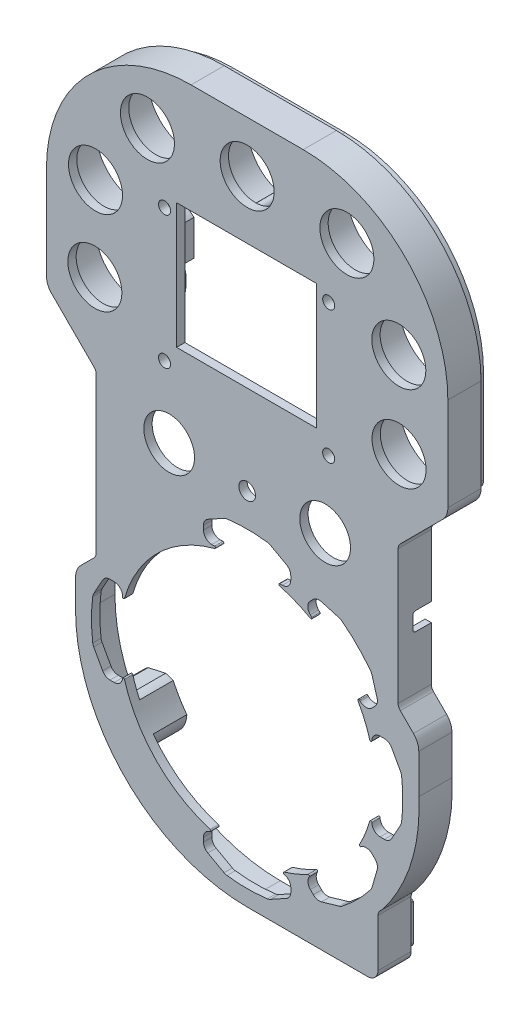
from build123d import *

# Parameters (mm, degrees)
SKETCH1_R               = 6.1
SKETCH1_R_2             = 6.5
BOSS_EXTRUDE1_DEPTH     = 2
CUT_EXTRUDE1_DEPTH      = 133.441116858
CUT_EXTRUDE3_DEPTH      = 133.441116858
BOSS_EXTRUDE4_START     = 5.980000305
BOSS_EXTRUDE4_DEPTH     = 5.980000305
CUT_EXTRUDE4_DEPTH      = 133.560966625
CUT_EXTRUDE4_DEPTH_BACK = 133.560966625
BOSS_EXTRUDE5_START     = 8.080000305
BOSS_EXTRUDE5_DEPTH     = 8.080000305
CUT_EXTRUDE5_DEPTH      = 3
CUT_EXTRUDE6_DEPTH      = 10
BOSS_EXTRUDE6_START     = 8.080000305
SKETCH15_R              = 1.25
BOSS_EXTRUDE6_DEPTH     = 8.080000305
SKETCH19_R              = 1.25
CUT_EXTRUDE10_DEPTH     = 8.080000305
FILLET1_R               = 0.25
CUT_EXTRUDE8_REACH      = 134.809
CUT_EXTRUDE9_DEPTH      = 172.733907758
CUT_EXTRUDE9_DEPTH_BACK = 10


with BuildPart() as part:
    # Sketch1 → Boss-Extrude1 (new body)
    with BuildSketch(Plane.XY):
        with BuildLine():
            Line((-41.299003107, 6.798191237), (-41.300003121, -0.001030065))
            ThreePointArc((-41.300003121, -0.001030065), (-29.203231295, -29.204249424), (-3.121e-06, -41.300999967))
            Line((-3.121e-06, -41.300999967), (28.999485949, -41.300999967))
            ThreePointArc((28.999485949, -41.300999967), (30.767175628, -40.564301116), (31.499997627, -38.795000714))
            Line((31.499997627, -38.795000714), (31.499997627, -27.309500836))
            ThreePointArc((31.499997627, -27.309500836), (31.63430244, -26.63385822), (32.017236672, -26.061239585))
            Line((32.017236672, -26.061239585), (32.524378638, -25.55409762))
            ThreePointArc((32.524378638, -25.55409762), (39.458657299, -12.419720481), (41.298997857, 2.3182994))
            Line((41.298997857, 2.3182994), (41.298997857, 11.797499352))
            ThreePointArc((41.298997857, 11.797499352), (40.96697133, 13.468656782), (40.020236823, 14.885238069))
            Line((40.020236823, 14.885238069), (36.855286312, 18.05018738))
            ThreePointArc((36.855286312, 18.05018738), (36.472344775, 18.623755543), (36.336999236, 19.299999763))
            Line((36.336999236, 19.299999763), (36.336999236, 51.568244042))
            ThreePointArc((36.336999236, 51.568244042), (36.478862282, 52.248666191), (36.865040827, 52.826563722))
            Line((36.865040827, 52.826563722), (47.030710936, 62.992234075))
            ThreePointArc((47.030710936, 62.992234075), (47.97660492, 64.408868533), (48.308999519, 66.079521832))
            Line((48.308999519, 66.079521832), (48.299999624, 88.500010224))
            ThreePointArc((48.299999624, 88.500010224), (38.107234824, 113.10724243), (13.499999624, 123.3))
            Line((13.499999624, 123.3), (-13.500010601, 123.3))
            ThreePointArc((-13.500010601, 123.3), (-38.107242807, 113.107235201), (-48.300000376, 88.5))
            Line((-48.300000376, 88.5), (-48.300000376, 66.070499878))
            ThreePointArc((-48.300000376, 66.070499878), (-47.96797385, 64.399342448), (-47.021239342, 62.982761162))
            Line((-47.021239342, 62.982761162), (-36.855288831, 52.816811851))
            ThreePointArc((-36.855288831, 52.816811851), (-36.472347294, 52.243243687), (-36.337001756, 51.566999468))
            Line((-36.337001756, 51.566999468), (-36.337000925, 14.30146916))
            ThreePointArc((-36.337000925, 14.30146916), (-36.471783381, 13.625120162), (-36.854241827, 13.051238803))
            Line((-36.854241827, 13.051238803), (-40.019899155, 9.885581347))
            ThreePointArc((-40.019899155, 9.885581347), (-40.966751427, 8.469200628), (-41.299003107, 6.798191237))
        make_face()
        with Locations((-18.767998896, 45.999999683)):
            Circle(SKETCH1_R, mode=Mode.SUBTRACT)
        with Locations((18.767988791, 45.999994761)):
            Circle(SKETCH1_R, mode=Mode.SUBTRACT)
        with Locations((36.549952387, 71.35011767)):
            Circle(SKETCH1_R_2, mode=Mode.SUBTRACT)
        with Locations((36.499964594, 92.000126825)):
            Circle(SKETCH1_R_2, mode=Mode.SUBTRACT)
        with Locations((23.9998883, 109.00006579)):
            Circle(SKETCH1_R_2, mode=Mode.SUBTRACT)
        with Locations((0.000117182, 111.000035272)):
            Circle(SKETCH1_R_2, mode=Mode.SUBTRACT)
        with Locations((-24.000058294, 108.999882684)):
            Circle(SKETCH1_R_2, mode=Mode.SUBTRACT)
        with Locations((-36.499959112, 91.999882684)):
            Circle(SKETCH1_R_2, mode=Mode.SUBTRACT)
        with Locations((-36.649960638, 71.649876581)):
            Circle(SKETCH1_R_2, mode=Mode.SUBTRACT)
        with BuildLine():
            Line((8.498217528, -29.999989932), (7.320711296, -29.999989932))
            ThreePointArc((7.320711296, -29.999989932), (11.855484749, -28.504033505), (16.103422547, -26.322960291))
            Line((16.103422547, -26.322960291), (15.206897602, -27.219485237))
            ThreePointArc((15.206897602, -27.219485237), (14.621111164, -28.633698799), (15.206897602, -30.047912361))
            Line((15.206897602, -30.047912361), (15.928049055, -30.769063814))
            ThreePointArc((15.928049055, -30.769063814), (16.84292629, -31.291513163), (17.896363573, -31.276560982))
            Line((17.896363573, -31.276560982), (22.183094016, -30.040536539))
            ThreePointArc((22.183094016, -30.040536539), (22.53156957, -29.903582275), (22.848411695, -29.704076008))
            ThreePointArc((22.848411695, -29.704076008), (26.504829459, -26.492827623), (29.714297788, -22.834847291))
            ThreePointArc((29.714297788, -22.834847291), (29.91343032, -22.518342524), (30.050164983, -22.17030134))
            Line((30.050164983, -22.17030134), (31.284907406, -17.888017149))
            ThreePointArc((31.284907406, -17.888017149), (31.299859587, -16.834579866), (30.777410238, -15.919702631))
            Line((30.777410238, -15.919702631), (30.056258785, -15.198551178))
            ThreePointArc((30.056258785, -15.198551178), (28.642045223, -14.612764741), (27.22783166, -15.198551178))
            Line((27.22783166, -15.198551178), (26.136786034, -16.289596804))
            ThreePointArc((26.136786034, -16.289596804), (28.474385236, -11.660635441), (29.999524405, -6.704265414))
            Line((29.999524405, -6.704265414), (29.999524405, -8.679270824))
            ThreePointArc((29.999524405, -8.679270824), (30.585310842, -10.093484386), (31.999524405, -10.679270824))
            Line((31.999524405, -10.679270824), (33.01938657, -10.679270824))
            ThreePointArc((33.01938657, -10.679270824), (34.035729944, -10.401782404), (34.770049802, -9.646316969))
            Line((34.770049802, -9.646316969), (36.927224702, -5.741139538))
            ThreePointArc((36.927224702, -5.741139538), (37.076792841, -5.397888822), (37.159761821, -5.032775373))
            ThreePointArc((37.159761821, -5.032775373), (37.474544109, -0.176602068), (37.157398229, 4.67941745))
            ThreePointArc((37.157398229, 4.67941745), (37.074403526, 5.044028081), (36.924987253, 5.386816369))
            Line((36.924987253, 5.386816369), (34.770049802, 9.2879433))
            ThreePointArc((34.770049802, 9.2879433), (34.035729944, 10.043408735), (33.01938657, 10.320897154))
            Line((33.01938657, 10.320897154), (31.999524405, 10.320897154))
            ThreePointArc((31.999524405, 10.320897154), (30.585310842, 9.735110716), (29.999524405, 8.320897154))
            Line((29.999524405, 8.320897154), (29.999524405, 6.332821196))
            ThreePointArc((29.999524405, 6.332821196), (28.260277654, 11.806823537), (25.53182947, 16.861054577))
            Line((25.53182947, 16.861054577), (27.202639399, 15.190244647))
            ThreePointArc((27.202639399, 15.190244647), (28.616852962, 14.60445821), (30.031066524, 15.190244647))
            Line((30.031066524, 15.190244647), (30.752217977, 15.9113961))
            ThreePointArc((30.752217977, 15.9113961), (31.274667326, 16.826273335), (31.259715145, 17.879710618))
            Line((31.259715145, 17.879710618), (30.023690702, 22.166441061))
            ThreePointArc((30.023690702, 22.166441061), (29.886736438, 22.514916616), (29.687230171, 22.83175874))
            ThreePointArc((29.687230171, 22.83175874), (26.475981786, 26.488176505), (22.818001454, 29.697644834))
            ThreePointArc((22.818001454, 29.697644834), (22.501496686, 29.896777366), (22.153455503, 30.033512029))
            Line((22.153455503, 30.033512029), (17.871171312, 31.268254451))
            ThreePointArc((17.871171312, 31.268254451), (16.817734029, 31.283206632), (15.902856794, 30.760757283))
            Line((15.902856794, 30.760757283), (15.181705341, 30.03960583))
            ThreePointArc((15.181705341, 30.03960583), (14.595918903, 28.625392268), (15.181705341, 27.211178706))
            Line((15.181705341, 27.211178706), (17.046324537, 25.346559509))
            ThreePointArc((17.046324537, 25.346559509), (11.557478813, 28.255519634), (5.59540313, 29.999976553))
            Line((5.59540313, 29.999976553), (8.493548338, 29.999976553))
            ThreePointArc((8.493548338, 29.999976553), (9.907761901, 30.585762991), (10.493548338, 31.999976553))
            Line((10.493548338, 31.999976553), (10.493548338, 33.019838718))
            ThreePointArc((10.493548338, 33.019838718), (10.216059919, 34.036182092), (9.460594484, 34.77050195))
            Line((9.460594484, 34.77050195), (5.555417053, 36.92767685))
            ThreePointArc((5.555417053, 36.92767685), (5.212166337, 37.077244989), (4.847052888, 37.16021397))
            ThreePointArc((4.847052888, 37.16021397), (-0.009120418, 37.474996257), (-4.865139935, 37.157850378))
            ThreePointArc((-4.865139935, 37.157850378), (-5.229750566, 37.074855674), (-5.572538855, 36.925439401))
            Line((-5.572538855, 36.925439401), (-9.473665785, 34.77050195))
            ThreePointArc((-9.473665785, 34.77050195), (-10.22913122, 34.036182092), (-10.506619639, 33.019838718))
            Line((-10.506619639, 33.019838718), (-10.506619639, 31.999976553))
            ThreePointArc((-10.506619639, 31.999976553), (-9.920833202, 30.585762991), (-8.506619639, 29.999976553))
            Line((-8.506619639, 29.999976553), (-5.596307426, 29.999976553))
            ThreePointArc((-5.596307426, 29.999976553), (-21.37256636, 21.853396161), (-29.999984316, 6.33486603))
            Line((-29.999984316, 6.33486603), (-29.999984316, 8.499295286))
            ThreePointArc((-29.999984316, 8.499295286), (-30.585770754, 9.913508849), (-31.999984316, 10.499295286))
            Line((-31.999984316, 10.499295286), (-33.019846482, 10.499295286))
            ThreePointArc((-33.019846482, 10.499295286), (-34.036189856, 10.221806867), (-34.770509714, 9.466341432))
            Line((-34.770509714, 9.466341432), (-36.927684614, 5.561164001))
            ThreePointArc((-36.927684614, 5.561164001), (-37.077252753, 5.217913285), (-37.160221733, 4.852799836))
            ThreePointArc((-37.160221733, 4.852799836), (-37.47500402, -0.00337347), (-37.157858141, -4.859392987))
            ThreePointArc((-37.157858141, -4.859392987), (-37.074863438, -5.224003618), (-36.925447164, -5.566791907))
            Line((-36.925447164, -5.566791907), (-34.770509714, -9.467918837))
            ThreePointArc((-34.770509714, -9.467918837), (-34.036189856, -10.223384272), (-33.019846482, -10.500872691))
            Line((-33.019846482, -10.500872691), (-31.999984316, -10.500872691))
            ThreePointArc((-31.999984316, -10.500872691), (-30.585770754, -9.915086254), (-29.999984316, -8.500872691))
            Line((-29.999984316, -8.500872691), (-29.999984316, -6.706310248))
            ThreePointArc((-29.999984316, -6.706310248), (-21.997212331, -21.601429929), (-7.321615592, -29.999989932))
            Line((-7.321615592, -29.999989932), (-8.50195045, -29.999989932))
            ThreePointArc((-8.50195045, -29.999989932), (-9.916164012, -30.58577637), (-10.50195045, -31.999989932))
            Line((-10.50195045, -31.999989932), (-10.50195045, -33.019852097))
            ThreePointArc((-10.50195045, -33.019852097), (-10.224462031, -34.036195472), (-9.468996596, -34.770515329))
            Line((-9.468996596, -34.770515329), (-5.563819165, -36.92769023))
            ThreePointArc((-5.563819165, -36.92769023), (-5.220568448, -37.077258368), (-4.855454999, -37.160227349))
            ThreePointArc((-4.855454999, -37.160227349), (0.000718306, -37.475009636), (4.856737824, -37.157863757))
            ThreePointArc((4.856737824, -37.157863757), (5.221348455, -37.074869053), (5.564136743, -36.92545278))
            Line((5.564136743, -36.92545278), (9.465263674, -34.770515329))
            ThreePointArc((9.465263674, -34.770515329), (10.220729109, -34.036195472), (10.498217528, -33.019852097))
            Line((10.498217528, -33.019852097), (10.498217528, -31.999989932))
            ThreePointArc((10.498217528, -31.999989932), (9.91243109, -30.58577637), (8.498217528, -29.999989932))
        make_face(mode=Mode.SUBTRACT)
    extrude(amount=BOSS_EXTRUDE1_DEPTH)

    # Sketch4 → Cut-Extrude1 (cut, through all)
    with BuildSketch(Plane.XY.offset(2)):
        Polygon((-16.977005171, 66.853991338), (16.722994829, 66.85399723), (16.722989557, 97.00399723), (-16.977010443, 97.003991338), align=None)
    extrude(amount=-CUT_EXTRUDE1_DEPTH, mode=Mode.SUBTRACT)

    # Sketch8 → Cut-Extrude3 (cut, through all)
    with BuildSketch(Plane(origin=(0, 0, 2), x_dir=(-1, 0, 0), z_dir=(0, 0, -1))):
        with BuildLine():
            add(Edge.make_bspline(
                [(21.327009938, 94.528990578), (21.327010445, 97.428990578), (18.427010445, 97.428991085), (18.427009938, 94.528991085), (18.427009431, 91.628991085), (21.327009431, 91.628990578), (21.327009938, 94.528990578)],
                knots=[0, 0, 0, 0, 0.5, 0.5, 0.5, 1, 1, 1, 1], degree=3, weights=[1, 0.333333333, 0.333333333, 1, 0.333333333, 0.333333333, 1]))
        make_face()
        with BuildLine():
            add(Edge.make_bspline(
                [(21.327004352, 62.578990578), (21.327004859, 65.478990578), (18.427004859, 65.478991085), (18.427004352, 62.578991085), (18.427003845, 59.678991085), (21.327003845, 59.678990578), (21.327004352, 62.578990578)],
                knots=[0, 0, 0, 0, 0.5, 0.5, 0.5, 1, 1, 1, 1], degree=3, weights=[1, 0.333333333, 0.333333333, 1, 0.333333333, 0.333333333, 1]))
        make_face()
        with BuildLine():
            add(Edge.make_bspline(
                [(-18.172995648, 62.578997484), (-18.172995141, 65.478997484), (-21.072995141, 65.478997991), (-21.072995648, 62.578997991), (-21.072996155, 59.678997991), (-18.172996155, 59.678997484), (-18.172995648, 62.578997484)],
                knots=[0, 0, 0, 0, 0.5, 0.5, 0.5, 1, 1, 1, 1], degree=3, weights=[1, 0.333333333, 0.333333333, 1, 0.333333333, 0.333333333, 1]))
        make_face()
        with BuildLine():
            add(Edge.make_bspline(
                [(-18.172990062, 94.528997484), (-18.172989555, 97.428997484), (-21.072989555, 97.428997991), (-21.072990062, 94.528997991), (-21.072990569, 91.628997991), (-18.172990569, 91.628997484), (-18.172990062, 94.528997484)],
                knots=[0, 0, 0, 0, 0.5, 0.5, 0.5, 1, 1, 1, 1], degree=3, weights=[1, 0.333333333, 0.333333333, 1, 0.333333333, 0.333333333, 1]))
        make_face()
    extrude(amount=CUT_EXTRUDE3_DEPTH, mode=Mode.SUBTRACT)

    # Sketch9 → Boss-Extrude4 (add)
    with BuildSketch(Plane(origin=(0, 0, 0), x_dir=(-1, 0, 0), z_dir=(0, 0, -1)).offset(BOSS_EXTRUDE4_START)):
        with BuildLine():
            Line((41.300003121, -0.001030065), (41.299003107, 6.798191237))
            ThreePointArc((41.299003107, 6.798191237), (40.966751427, 8.469200628), (40.019899155, 9.885581347))
            Line((40.019899155, 9.885581347), (36.854241827, 13.051238803))
            ThreePointArc((36.854241827, 13.051238803), (36.471783381, 13.625120162), (36.337000925, 14.30146916))
            Line((36.337000925, 14.30146916), (36.337001756, 51.566999468))
            ThreePointArc((36.337001756, 51.566999468), (36.472347294, 52.243243687), (36.855288831, 52.816811851))
            Line((36.855288831, 52.816811851), (47.021239342, 62.982761162))
            ThreePointArc((47.021239342, 62.982761162), (47.96797385, 64.399342448), (48.300000376, 66.070499878))
            Line((48.300000376, 66.070499878), (48.300000376, 88.5))
            ThreePointArc((48.300000376, 88.5), (38.107242807, 113.107235201), (13.500010601, 123.3))
            Line((13.500010601, 123.3), (-13.499999624, 123.3))
            ThreePointArc((-13.499999624, 123.3), (-38.107234824, 113.10724243), (-48.299999624, 88.500010224))
            Line((-48.299999624, 88.500010224), (-48.308999519, 66.079521832))
            ThreePointArc((-48.308999519, 66.079521832), (-47.97660492, 64.408868533), (-47.030710936, 62.992234075))
            Line((-47.030710936, 62.992234075), (-36.865040827, 52.826563722))
            ThreePointArc((-36.865040827, 52.826563722), (-36.478862282, 52.248666191), (-36.336999236, 51.568244042))
            Line((-36.336999236, 51.568244042), (-36.336999236, 19.299999763))
            ThreePointArc((-36.336999236, 19.299999763), (-36.472344775, 18.623755543), (-36.855286312, 18.05018738))
            Line((-36.855286312, 18.05018738), (-40.020236823, 14.885238069))
            ThreePointArc((-40.020236823, 14.885238069), (-40.96697133, 13.468656782), (-41.298997857, 11.797499352))
            Line((-41.298997857, 11.797499352), (-41.298997857, 2.3182994))
            ThreePointArc((-41.298997857, 2.3182994), (-39.458657299, -12.419720481), (-32.524378638, -25.55409762))
            Line((-32.524378638, -25.55409762), (-32.017236672, -26.061239585))
            ThreePointArc((-32.017236672, -26.061239585), (-31.63430244, -26.63385822), (-31.499997627, -27.309500836))
            Line((-31.499997627, -27.309500836), (-31.499997627, -38.795000714))
            ThreePointArc((-31.499997627, -38.795000714), (-30.767175628, -40.564301116), (-28.999485949, -41.300999967))
            Line((-28.999485949, -41.300999967), (3.121e-06, -41.300999967))
            ThreePointArc((3.121e-06, -41.300999967), (29.203231295, -29.204249424), (41.300003121, -0.001030065))
        make_face()
        with BuildLine():
            Line((-34.836999236, 51.577035852), (-34.837000675, 19.298530673))
            ThreePointArc((-34.837000675, 19.298530673), (-35.08664303, 18.049447619), (-35.794020766, 16.990133274))
            Line((-35.794020766, 16.990133274), (-38.959715536, 13.824439048))
            ThreePointArc((-38.959715536, 13.824439048), (-39.581134457, 12.894674146), (-39.798997912, 11.797787744))
            Line((-39.798997912, 11.797787744), (-39.798997857, 2.275492803))
            ThreePointArc((-39.798997857, 2.275492803), (-38.047420179, -11.907055573), (-31.400013755, -24.557142159))
            Line((-31.400013755, -24.557142159), (-30.956920002, -25.000236134))
            ThreePointArc((-30.956920002, -25.000236134), (-30.248520921, -26.059741977), (-29.999997682, -27.309789227))
            Line((-29.999997682, -27.309789227), (-29.999998042, -38.794212098))
            ThreePointArc((-29.999998042, -38.794212098), (-29.705742188, -39.504415445), (-28.996508448, -39.800999967))
            Line((-28.996508448, -39.800999967), (-1.3697e-05, -39.800999968))
            ThreePointArc((-1.3697e-05, -39.800999968), (28.142532317, -28.143628059), (39.800003129, -0.001123009))
            Line((39.800003129, -0.001123009), (39.799003134, 6.798250529))
            ThreePointArc((39.799003134, 6.798250529), (39.580974331, 7.895073776), (38.959436668, 8.824723564))
            Line((38.959436668, 8.824723564), (35.792533025, 11.991629339))
            ThreePointArc((35.792533025, 11.991629339), (35.085842634, 13.05138922), (34.837001404, 14.300621278))
            Line((34.837001404, 14.300621278), (34.837003194, 51.568468574))
            ThreePointArc((34.837003194, 51.568468574), (35.086645534, 52.817551574), (35.794023216, 53.876865887))
            Line((35.794023216, 53.876865887), (45.960717986, 64.043560114))
            ThreePointArc((45.960717986, 64.043560114), (46.582136958, 64.97332504), (46.800000432, 66.070211487))
            Line((46.800000432, 66.070211487), (46.800000376, 88.499994322))
            ThreePointArc((46.800000376, 88.499994322), (37.046582557, 112.046575107), (13.500004702, 121.8))
            Line((13.500004702, 121.8), (-13.499993945, 121.8))
            ThreePointArc((-13.499993945, 121.8), (-37.046681171, 112.046475739), (-46.799999684, 88.499703265))
            Line((-46.799999684, 88.499703265), (-46.8089996, 66.079396043))
            ThreePointArc((-46.8089996, 66.079396043), (-46.590687906, 64.982657224), (-45.969777952, 64.052621294))
            Line((-45.969777952, 64.052621294), (-35.802337039, 53.885180277))
            ThreePointArc((-35.802337039, 53.885180277), (-35.094172189, 52.825417485), (-34.836999236, 51.577035852))
        make_face(mode=Mode.SUBTRACT)
    extrude(amount=-BOSS_EXTRUDE4_DEPTH)

    # Sketch10 → Cut-Extrude4 (cut, two sides: drawn at the far end of the back side and taken through both)
    with BuildSketch(Plane.ZY.offset(-CUT_EXTRUDE4_DEPTH_BACK)):
        with BuildLine():
            Line((-5.230000341, 36.549993102), (-2.230000341, 36.549993102))
            ThreePointArc((-2.230000341, 36.549993102), (-1.962121942, 36.496708778), (-1.735025597, 36.344967862))
            ThreePointArc((-1.735025597, 36.344967862), (-1.58328466, 36.117871523), (-1.530000319, 35.849993121))
            Line((-1.530000319, 35.849993121), (-1.530000319, 32.84999311))
            ThreePointArc((-1.530000319, 32.84999311), (-1.583284635, 32.582114708), (-1.73502555, 32.355018359))
            ThreePointArc((-1.73502555, 32.355018359), (-1.962121896, 32.203277423), (-2.230000305, 32.149993091))
            Line((-2.230000305, 32.149993091), (-5.230000305, 32.149993091))
            Line((-5.230000305, 32.149993091), (-5.980000305, 32.149993091))
            Line((-5.980000305, 32.149993091), (-5.980000305, 36.549993102))
            Line((-5.980000305, 36.549993102), (-5.230000341, 36.549993102))
        make_face()
    extrude(amount=CUT_EXTRUDE4_DEPTH + CUT_EXTRUDE4_DEPTH_BACK, mode=Mode.SUBTRACT)

    # Sketch11 → Boss-Extrude5 (add)
    # profile 1 of 2: a face of its own
    with BuildSketch(Plane(origin=(0, 0, 0), x_dir=(-1, 0, 0), z_dir=(0, 0, -1)).offset(BOSS_EXTRUDE5_START)):
        with BuildLine():
            ThreePointArc((-11.205806713, 106.994723534), (-7.384503856, 101.668324097), (-1.322339404, 99.173720191))
            Line((-1.322339404, 99.173720191), (1.322105041, 99.173720191))
            ThreePointArc((1.322105041, 99.173720191), (7.384269493, 101.668324097), (11.20557235, 106.994723534))
            Line((11.20557235, 106.994723534), (12.270210464, 106.994723534))
            ThreePointArc((12.270210464, 106.994723534), (17.045409632, 99.343648536), (25.815393125, 97.239161604))
            ThreePointArc((25.815393125, 97.239161604), (25.092007234, 88.613346487), (30.404739825, 81.779398434))
            ThreePointArc((30.404739825, 81.779398434), (25.694421402, 67.003786378), (39.590634433, 60.118942538))
            Line((39.590634433, 60.118942538), (42.778331278, 60.931884116))
            ThreePointArc((42.778331278, 60.931884116), (42.85498099, 60.960869655), (42.92329232, 61.006134455))
            Line((42.92329232, 61.006134455), (45.960717986, 64.043560114))
            ThreePointArc((45.960717986, 64.043560114), (46.582136959, 64.973325041), (46.800000413, 66.070211487))
            Line((46.800000413, 66.070211487), (46.800000376, 88.499994322))
            ThreePointArc((46.800000376, 88.499994322), (37.046582557, 112.046575107), (13.500004702, 121.8))
            Line((13.500004702, 121.8), (-13.499993945, 121.8))
            ThreePointArc((-13.499993945, 121.8), (-37.046681176, 112.046475735), (-46.799999654, 88.499703265))
            Line((-46.799999654, 88.499703265), (-46.8089996, 66.079396043))
            ThreePointArc((-46.8089996, 66.079396043), (-46.590687908, 64.982657227), (-45.969777975, 64.052621271))
            Line((-45.969777975, 64.052621271), (-44.184961095, 62.26780438))
            Line((-44.184961095, 62.26780438), (-44.122149582, 62.204992868))
            ThreePointArc((-44.122149582, 62.204992868), (-43.886865038, 61.989568793), (-43.637309154, 61.790852389))
            ThreePointArc((-43.637309154, 61.790852389), (-26.598105347, 64.824629446), (-30.60858936, 81.66073017))
            ThreePointArc((-30.60858936, 81.66073017), (-25.126151376, 88.500567519), (-25.81537685, 97.239301377))
            ThreePointArc((-25.81537685, 97.239301377), (-17.045347849, 99.343683082), (-12.270056125, 106.994723534))
            Line((-12.270056125, 106.994723534), (-11.205806713, 106.994723534))
        make_face()
        with BuildLine():
            Line((-37.649952387, 81.188816771), (-37.649952387, 79.55011767))
            ThreePointArc((-37.649952387, 79.55011767), (-36.549952387, 78.45011767), (-35.449952387, 79.55011767))
            Line((-35.449952387, 79.55011767), (-35.449952387, 81.188816771))
            ThreePointArc((-35.449952387, 81.188816771), (-36.549952387, 61.45011767), (-37.649952387, 81.188816771))
        make_face(mode=Mode.SUBTRACT)
        with BuildLine():
            Line((35.549960638, 81.488575682), (35.549960638, 79.849876581))
            ThreePointArc((35.549960638, 79.849876581), (36.649960638, 78.749876581), (37.749960638, 79.849876581))
            Line((37.749960638, 79.849876581), (37.749960638, 81.488575682))
            ThreePointArc((37.749960638, 81.488575682), (36.649960638, 61.749876581), (35.549960638, 81.488575682))
        make_face(mode=Mode.SUBTRACT)
        with BuildLine():
            Line((-37.599964594, 101.838825926), (-37.599964594, 100.200126825))
            ThreePointArc((-37.599964594, 100.200126825), (-36.499964594, 99.100126825), (-35.399964594, 100.200126825))
            Line((-35.399964594, 100.200126825), (-35.399964594, 101.838825926))
            ThreePointArc((-35.399964594, 101.838825926), (-36.499964594, 82.100126825), (-37.599964594, 101.838825926))
        make_face(mode=Mode.SUBTRACT)
        with BuildLine():
            Line((-25.0998883, 118.838764891), (-25.0998883, 117.20006579))
            ThreePointArc((-25.0998883, 117.20006579), (-23.9998883, 116.10006579), (-22.8998883, 117.20006579))
            Line((-22.8998883, 117.20006579), (-22.8998883, 118.838764891))
            ThreePointArc((-22.8998883, 118.838764891), (-23.9998883, 99.10006579), (-25.0998883, 118.838764891))
        make_face(mode=Mode.SUBTRACT)
        with BuildLine():
            Line((35.399959112, 101.838581785), (35.399959112, 100.199882684))
            ThreePointArc((35.399959112, 100.199882684), (36.499959112, 99.099882684), (37.599959112, 100.199882684))
            Line((37.599959112, 100.199882684), (37.599959112, 101.838581785))
            ThreePointArc((37.599959112, 101.838581785), (36.499959112, 82.099882684), (35.399959112, 101.838581785))
        make_face(mode=Mode.SUBTRACT)
        with BuildLine():
            Line((1.099882818, 101.161336171), (1.099882818, 102.800035272))
            ThreePointArc((1.099882818, 102.800035272), (-0.000117182, 103.900035272), (-1.100117182, 102.800035272))
            Line((-1.100117182, 102.800035272), (-1.100117182, 101.161336171))
            ThreePointArc((-1.100117182, 101.161336171), (-0.000117182, 120.900035272), (1.099882818, 101.161336171))
        make_face(mode=Mode.SUBTRACT)
        with BuildLine():
            Line((22.900058294, 118.838581785), (22.900058294, 117.199882684))
            ThreePointArc((22.900058294, 117.199882684), (24.000058294, 116.099882684), (25.100058294, 117.199882684))
            Line((25.100058294, 117.199882684), (25.100058294, 118.838581785))
            ThreePointArc((25.100058294, 118.838581785), (24.000058294, 99.099882684), (22.900058294, 118.838581785))
        make_face(mode=Mode.SUBTRACT)
    # profile 2 of 2: a face of its own
    with BuildSketch(Plane(origin=(0, 0, 0), x_dir=(-1, 0, 0), z_dir=(0, 0, -1)).offset(BOSS_EXTRUDE5_START)):
        with BuildLine():
            ThreePointArc((-44.184961095, 62.26780438), (-44.15370593, 62.236248032), (-44.122149582, 62.204992868))
            Line((-44.122149582, 62.204992868), (-44.184961095, 62.26780438))
        make_face()
    extrude(amount=-BOSS_EXTRUDE5_DEPTH)

    # Sketch12 → Cut-Extrude5 (cut)
    with BuildSketch(Plane(origin=(0, 0, -8.080000305), x_dir=(-1, 0, 0), z_dir=(0, 0, -1))):
        with BuildLine():
            Line((32.142188085, 60.636703347), (31.824493662, 61.81748044))
            Line((31.824493662, 61.81748044), (28.717466466, 64.924507637))
            Line((28.717466466, 64.924507637), (26.546648647, 65.508577838))
            Line((26.546648647, 65.508577838), (26.490897394, 65.452826585))
            ThreePointArc((26.490897394, 65.452826585), (28.931296335, 62.592712701), (32.142188085, 60.636703347))
        make_face()
    extrude(amount=-CUT_EXTRUDE5_DEPTH, mode=Mode.SUBTRACT)

    # Sketch13 → Cut-Extrude6 (cut)
    with BuildSketch(Plane(origin=(-36.337000606, -8.1e-07, 0), x_dir=(0, 0, 1), z_dir=(-0.9999999999999998, -2.2293126995206843e-08, 0))):
        with BuildLine():
            ThreePointArc((-6.370001267, 50.324877349), (-7.670001267, 49.024877349), (-6.370001267, 47.724877349))
            ThreePointArc((-6.370001267, 47.724877349), (-5.070001267, 49.024877349), (-6.370001267, 50.324877349))
        make_face()
        with BuildLine():
            ThreePointArc((-6.370001267, 43.699877349), (-7.670001267, 42.399877349), (-6.370001267, 41.099877349))
            ThreePointArc((-6.370001267, 41.099877349), (-5.070001267, 42.399877349), (-6.370001267, 43.699877349))
        make_face()
    extrude(amount=-CUT_EXTRUDE6_DEPTH, mode=Mode.SUBTRACT)

    # Sketch15 → Boss-Extrude6 (add)
    # profile 1 of 6: a face of its own
    with BuildSketch(Plane(origin=(0, 0, 0), x_dir=(-1, 0, 0), z_dir=(0, 0, -1)).offset(BOSS_EXTRUDE6_START)):
        with BuildLine():
            ThreePointArc((-35.034535657, 52.811927268), (-35.345612209, 53.402616178), (-35.766922921, 53.92047648))
            Line((-35.766922921, 53.92047648), (-43.637307741, 61.790854495))
            ThreePointArc((-43.637307741, 61.790854495), (-35.801426671, 59.473678518), (-28.318483151, 62.756344041))
            ThreePointArc((-28.318483151, 62.756344041), (-26.511078256, 60.812490199), (-25.719156766, 58.279085263))
            Line((-25.719156766, 58.279085263), (-27.620794287, 58.279085263))
            Line((-27.620794287, 58.279085263), (-27.620794287, 53.399989899))
            ThreePointArc((-27.620794287, 53.399989899), (-31.225565667, 51.818786432), (-35.034535657, 52.811927268))
        make_face()
        with Locations((-31.699999271, 57.79999975)):
            Circle(SKETCH15_R, mode=Mode.SUBTRACT)
    # profile 2 of 6: a face of its own
    with BuildSketch(Plane(origin=(0, 0, 0), x_dir=(-1, 0, 0), z_dir=(0, 0, -1)).offset(BOSS_EXTRUDE6_START)):
        with BuildLine():
            ThreePointArc((12.270210464, 106.994723534), (13.704376619, 103.032560392), (16.429452298, 99.818601482))
            ThreePointArc((16.429452298, 99.818601482), (15.904666451, 98.614794638), (15.130555253, 97.553991661))
            Line((15.130555253, 97.553991661), (6.269444084, 97.55399321))
            ThreePointArc((6.269444084, 97.55399321), (5.412798911, 98.763540822), (4.878797332, 100.14617913))
            ThreePointArc((4.878797332, 100.14617913), (8.740835967, 102.925028272), (11.20557235, 106.994723534))
            Line((11.20557235, 106.994723534), (12.270210464, 106.994723534))
        make_face()
        with Locations((10.700000376, 101.6)):
            Circle(SKETCH15_R, mode=Mode.SUBTRACT)
    # profile 3 of 6: a face of its own
    with BuildSketch(Plane(origin=(0, 0, 0), x_dir=(-1, 0, 0), z_dir=(0, 0, -1)).offset(BOSS_EXTRUDE6_START)):
        with BuildLine():
            ThreePointArc((25.491586769, 87.480398401), (27.485605879, 84.231264045), (30.404739542, 81.779398444))
            ThreePointArc((30.404739542, 81.779398444), (27.487894425, 79.243725577), (25.53750284, 75.907021366))
            ThreePointArc((25.53750284, 75.907021366), (24.107710412, 76.499403806), (22.87700695, 77.437802618))
            Line((22.87700695, 77.437802618), (22.87700844, 85.962198858))
            ThreePointArc((22.87700844, 85.962198858), (24.087102251, 86.888684312), (25.491586769, 87.480398401))
        make_face()
        with Locations((27.100000376, 81.7)):
            Circle(SKETCH15_R, mode=Mode.SUBTRACT)
    # profile 4 of 6: a face of its own
    with BuildSketch(Plane(origin=(0, 0, 0), x_dir=(-1, 0, 0), z_dir=(0, 0, -1)).offset(BOSS_EXTRUDE6_START)):
        with BuildLine():
            Line((34.787001217, 19.418424535), (34.787001408, 25.781575161))
            ThreePointArc((34.787001408, 25.781575161), (23.700000376, 22.60000018), (34.787001217, 19.418424535))
        make_face()
        with Locations((29.700000376, 22.6)):
            Circle(SKETCH15_R, mode=Mode.SUBTRACT)
    # profile 5 of 6: a face of its own
    with BuildSketch(Plane(origin=(0, 0, 0), x_dir=(-1, 0, 0), z_dir=(0, 0, -1)).offset(BOSS_EXTRUDE6_START)):
        with BuildLine():
            Line((29.700000376, -12.46788402), (33.914160278, -13.398365853))
            ThreePointArc((33.914160278, -13.398365853), (35.310695247, -14.683906106), (36.23577816, -16.341357542))
            ThreePointArc((36.23577816, -16.341357542), (34.065861697, -20.483976018), (31.424444939, -24.343087679))
            ThreePointArc((31.424444939, -24.343087679), (26.716616088, -22.973765021), (24.601884414, -18.550349262))
            ThreePointArc((24.601884414, -18.550349262), (26.38064477, -15.888442804), (27.872516175, -13.055766666))
            ThreePointArc((27.872516175, -13.055766666), (28.762594077, -12.688263128), (29.700000376, -12.46788402))
        make_face()
        with Locations((30.600000376, -18.4)):
            Circle(SKETCH15_R, mode=Mode.SUBTRACT)
    # profile 6 of 6: a face of its own
    with BuildSketch(Plane(origin=(0, 0, 0), x_dir=(-1, 0, 0), z_dir=(0, 0, -1)).offset(BOSS_EXTRUDE6_START)):
        with BuildLine():
            Line((-29.949998487, -30.156439017), (-29.949998487, -38.794254181))
            ThreePointArc((-29.949998487, -38.794254181), (-29.670326948, -39.469120456), (-28.996379997, -39.751000159))
            Line((-28.996379997, -39.751000159), (-23.046586974, -39.751000159))
            Line((-23.046586974, -39.751000159), (-23.046586974, -32.638286128))
            Line((-23.046586974, -32.638286128), (-27.620794287, -29.271076565))
            ThreePointArc((-27.620794287, -29.271076565), (-28.831864158, -29.591510763), (-29.949998487, -30.156439017))
        make_face()
        with Locations((-26.700000329, -35.200000454)):
            Circle(SKETCH15_R, mode=Mode.SUBTRACT)
    extrude(amount=-BOSS_EXTRUDE6_DEPTH)

    # Sketch19 → Cut-Extrude10 (cut)
    with BuildSketch(Plane(origin=(0, 0, -8.080000305), x_dir=(-1, 0, 0), z_dir=(0, 0, -1))):
        with Locations((-37.599999624, 105.6)):
            Circle(SKETCH19_R)
    extrude(amount=-CUT_EXTRUDE10_DEPTH, mode=Mode.SUBTRACT)

    # Fillet1
    fillet1_edges = [part.edges().sort_by_distance(p)[0] for p in [
        (-29.999984316, 6.33486603, 1),
        (-29.999984316, -6.706310248, 1),
        (-7.321615592, -29.999989932, 1),
        (7.320711296, -29.999989932, 1),
        (16.103422547, -26.322960291, 1),
        (29.999524405, -6.704265414, 1),
        (26.136786034, -16.289596804, 1),
        (29.999524405, 6.332821196, 1),
        (25.53182947, 16.861054577, 1),
        (17.046324537, 25.346559509, 1),
        (5.59540313, 29.999976553, 1),
        (-5.596307426, 29.999976553, 1),
    ]]
    fillet(fillet1_edges, radius=FILLET1_R)

    # Sketch18 → Cut-Extrude8 (cut, up to next)
    with BuildSketch(Plane.XY.offset(2), mode=Mode.PRIVATE) as cut_extrude8_sk1:
        with BuildLine():
            add(Edge.make_bspline(
                [(-8.1183e-05, 47.39995294), (-4.000081183, 47.39995294), (-4.000081183, 43.39995294), (-8.1183e-05, 43.39995294), (3.999918817, 43.39995294), (3.999918817, 47.39995294), (-8.1183e-05, 47.39995294)],
                knots=[0, 0, 0, 0, 0.5, 0.5, 0.5, 1, 1, 1, 1], degree=3, weights=[1, 0.333333333, 0.333333333, 1, 0.333333333, 0.333333333, 1]))
        make_face()
    cut_extrude8_tool1 = extrude(cut_extrude8_sk1.sketch, amount=-CUT_EXTRUDE8_REACH, mode=Mode.PRIVATE) & part.part
    add(cut_extrude8_tool1.solids().sort_by_distance((-8.1e-05, 45.400376, 2))[0], mode=Mode.SUBTRACT)

    # Sketch16 → Cut-Extrude9 (cut, two sides: drawn at the far end of the back side and taken through both)
    with BuildSketch(Plane.XZ.offset(41.300999967).offset(-CUT_EXTRUDE9_DEPTH_BACK)):
        with BuildLine():
            add(Edge.make_bspline(
                [(21.320046807, -4.770000419), (22.031932697, -4.770000055), (22.546505394, -5.264684971), (22.569407278, -5.980000305)],
                knots=[0, 0, 0, 0, 0.97751578, 0.97751578, 0.97751578, 0.97751578], degree=3, weights=[1, 0.809128054, 0.804836447, 0.987125179]))
            Line((21.320046807, -4.770000419), (14.880047446, -4.770000419))
            add(Edge.make_bspline(
                [(13.630687613, -5.980000305), (13.653589488, -5.264685272), (14.16816184, -4.770000419), (14.880047446, -4.770000419)],
                knots=[0.022484146, 0.022484146, 0.022484146, 0.022484146, 1, 1, 1, 1], degree=3, weights=[0.987125231, 0.804836594, 0.809128184, 1]))
            Line((13.630687613, -5.980000305), (22.569407278, -5.980000305))
        make_face()
    extrude(amount=CUT_EXTRUDE9_DEPTH + CUT_EXTRUDE9_DEPTH_BACK, mode=Mode.SUBTRACT)


solid = part.part
